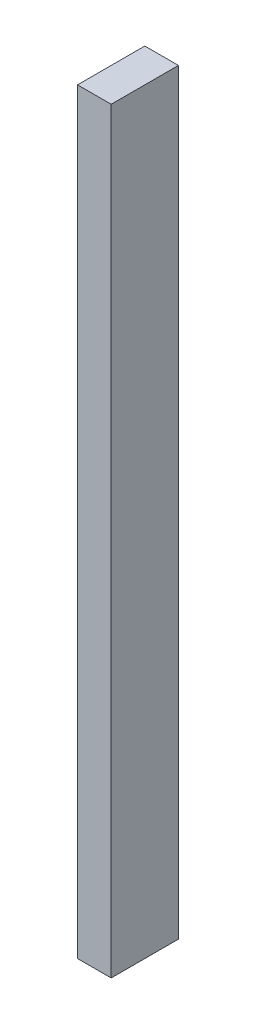
from build123d import *

# Parameters (mm, degrees)
SKETCH1_W           = 40
SKETCH1_H           = 80
BOSS_EXTRUDE1_DEPTH = 900


with BuildPart() as part:
    # Sketch1 → Boss-Extrude1 (new body)
    with BuildSketch(Plane(origin=(0, 0, 0), x_dir=(1, 0, 0), z_dir=(0, 1, 0))):
        with Locations((20, 40)):
            Rectangle(SKETCH1_W, SKETCH1_H)
    extrude(amount=BOSS_EXTRUDE1_DEPTH)


solid = part.part
